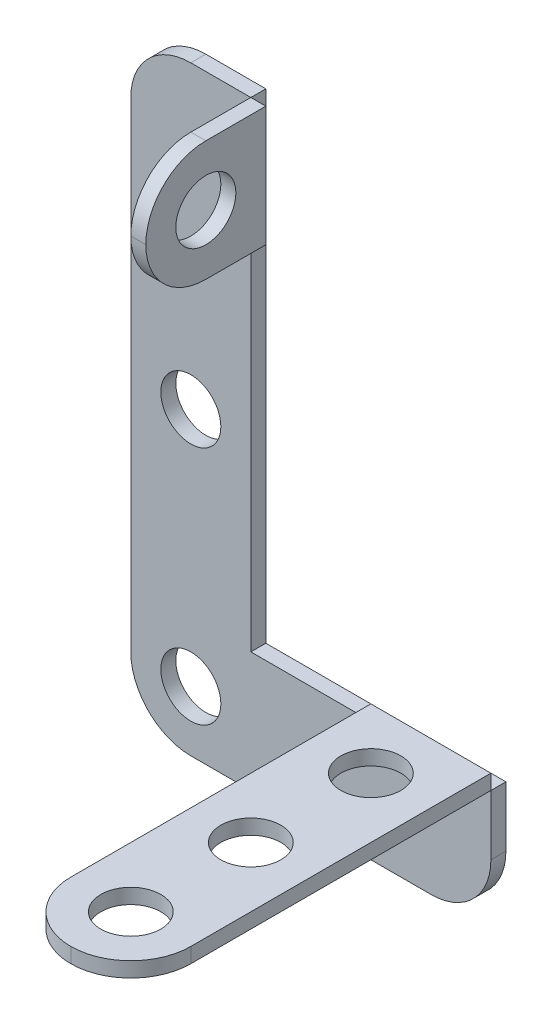
from build123d import *

# Parameters (mm, degrees)
SKETCH1_R           = 3.175
BOSS_EXTRUDE1_DEPTH = 1.5875
SKETCH2_W           = 12.7
SKETCH2_H           = 12.7
SKETCH2_R           = 3.175
BOSS_EXTRUDE2_DEPTH = 1.5875
SKETCH3_W           = 12.7
SKETCH3_H           = 38.1
SKETCH3_R           = 3.175
BOSS_EXTRUDE3_DEPTH = 1.5875
FILLET1_R           = 6.35
FILLET2_R           = 6.35
FILLET3_R           = 6.35


with BuildPart() as part:
    # Sketch1 → Boss-Extrude1 (new body)
    with BuildSketch(Plane.XY):
        Polygon((12.7, 0), (38.1, 0), (38.1, 12.7), (12.7, 12.7), (12.7, 63.5), (0, 63.5), (0, 0), align=None)
        with Locations((6.35, 31.75)):
            Circle(SKETCH1_R, mode=Mode.SUBTRACT)
        with Locations((6.35, 6.35)):
            Circle(SKETCH1_R, mode=Mode.SUBTRACT)
    extrude(amount=BOSS_EXTRUDE1_DEPTH)

    # Fillet3
    fillet3_edges = [part.edges().sort_by_distance(p)[0] for p in [
        (0, 0, 0.79375),
        (0, 63.5, 0.79375),
        (38.1, 0, 0.79375),
    ]]
    fillet(fillet3_edges, radius=FILLET3_R)


with BuildPart() as body_2:
    # Sketch2 → Boss-Extrude2 (new body)
    with BuildSketch(Plane(origin=(12.7, 0, 0), x_dir=(0, 0, -1), z_dir=(1, 0, 0))):
        with Locations((-7.9375, 57.15)):
            Rectangle(SKETCH2_W, SKETCH2_H)
        with Locations(Location((-7.9375, 57.15, 0), (0, 0, 90))):
            Circle(SKETCH2_R, mode=Mode.SUBTRACT)
    extrude(amount=BOSS_EXTRUDE2_DEPTH)

    # Fillet2
    fillet2_edges = [body_2.edges().sort_by_distance(p)[0] for p in [
        (13.49375, 50.8, 14.2875),
        (13.49375, 63.5, 14.2875),
    ]]
    fillet(fillet2_edges, radius=FILLET2_R - 0.0001)  # a hair under: the kernel refuses the full size


with BuildPart() as body_3:
    # Sketch3 → Boss-Extrude3 (new body)
    with BuildSketch(Plane(origin=(0, 12.7, 0), x_dir=(1, 0, 0), z_dir=(0, 1, 0))):
        with Locations((31.75, -20.6375)):
            Rectangle(SKETCH3_W, SKETCH3_H)
        with Locations(Location((31.75, -7.9375, 0), (0, 0, 180))):
            Circle(SKETCH3_R, mode=Mode.SUBTRACT)
        with Locations(Location((31.75, -20.6375, 0), (0, 0, 180))):
            Circle(SKETCH3_R, mode=Mode.SUBTRACT)
        with Locations(Location((31.75, -33.3375, 0), (0, 0, 180))):
            Circle(SKETCH3_R, mode=Mode.SUBTRACT)
    extrude(amount=BOSS_EXTRUDE3_DEPTH)

    # Fillet1
    fillet1_edges = [body_3.edges().sort_by_distance(p)[0] for p in [
        (25.4, 13.49375, 39.6875),
        (38.1, 13.49375, 39.6875),
    ]]
    fillet(fillet1_edges, radius=FILLET1_R - 0.0001)  # a hair under: the kernel refuses the full size


solid = Compound([part.part, body_2.part, body_3.part])
